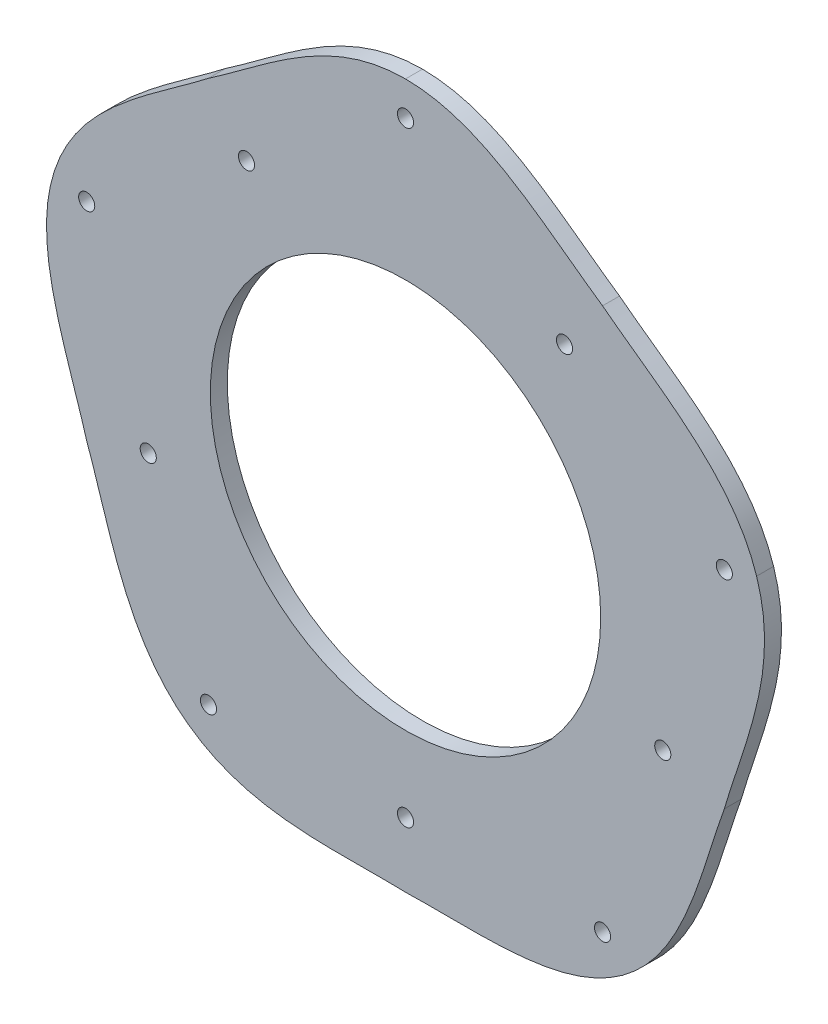
from build123d import *

# Parameters (mm, degrees)
SZKIC1_R                    = 1.9
SZKIC1_R_2                  = 46
DODANIE_WYCI_GNI_CIE1_DEPTH = 4


with BuildPart() as part:
    # Szkic1 → Dodanie-wyciągnięcie1 (new body)
    with BuildSketch(Plane.XY):
        with BuildLine():
            add(Edge.make_bspline(
                [(0, 87), (18.224844976, 86.998612649), (32.288902875, 73.536902698), (46.435034931, 63.912342556)],
                knots=[0, 0, 0, 0, 1, 1, 1, 1], degree=3))
            add(Edge.make_bspline(
                [(0, 87), (-18.224844976, 86.998612649), (-32.288902875, 73.536902698), (-46.435034931, 63.912342556)],
                knots=[0, 0, 0, 0, 1, 1, 1, 1], degree=3))
            add(Edge.make_bspline(
                [(-82.741916918, 26.884478511), (-77.108810651, 44.216907368), (-59.959930782, 53.43272413), (-46.435034931, 63.912342556)],
                knots=[0, 0, 0, 0, 1, 1, 1, 1], degree=3))
            add(Edge.make_bspline(
                [(-82.741916918, 26.884478511), (-88.372384286, 9.551192223), (-79.915570217, -7.984418835), (-75.133464787, -24.412342556)],
                knots=[0, 0, 0, 0, 1, 1, 1, 1], degree=3))
            add(Edge.make_bspline(
                [(-51.137316949, -70.384478511), (-65.88071079, -59.671061018), (-69.346178061, -40.513663074), (-75.133464787, -24.412342556)],
                knots=[0, 0, 0, 0, 1, 1, 1, 1], degree=3))
            add(Edge.make_bspline(
                [(-51.137316949, -70.384478511), (-36.39229218, -81.095651222), (-17.10163575, -78.471544919), (0, -79)],
                knots=[0, 0, 0, 0, 1, 1, 1, 1], degree=3))
            add(Edge.make_bspline(
                [(51.137316949, -70.384478511), (36.39229218, -81.095651222), (17.10163575, -78.471544919), (0, -79)],
                knots=[0, 0, 0, 0, 1, 1, 1, 1], degree=3))
            add(Edge.make_bspline(
                [(51.137316949, -70.384478511), (65.88071079, -59.671061018), (69.346178061, -40.513663074), (75.133464787, -24.412342556)],
                knots=[0, 0, 0, 0, 1, 1, 1, 1], degree=3))
            add(Edge.make_bspline(
                [(82.741916918, 26.884478511), (88.372384286, 9.551192223), (79.915570217, -7.984418835), (75.133464787, -24.412342556)],
                knots=[0, 0, 0, 0, 1, 1, 1, 1], degree=3))
            add(Edge.make_bspline(
                [(82.741916918, 26.884478511), (77.108810651, 44.216907368), (59.959930782, 53.43272413), (46.435034931, 63.912342556)],
                knots=[0, 0, 0, 0, 1, 1, 1, 1], degree=3))
        make_face()
        with Locations((-46.435034931, -63.912342556)):
            Circle(SZKIC1_R, mode=Mode.SUBTRACT)
        with Locations((75.133464787, 24.412342556)):
            Circle(SZKIC1_R, mode=Mode.SUBTRACT)
        with Locations((46.435034931, -63.912342556)):
            Circle(SZKIC1_R, mode=Mode.SUBTRACT)
        with Locations((-75.133464787, 24.412342556)):
            Circle(SZKIC1_R, mode=Mode.SUBTRACT)
        with Locations((0, 79)):
            Circle(SZKIC1_R, mode=Mode.SUBTRACT)
        with Locations((37.471309834, 51.574833391)):
            Circle(SZKIC1_R, mode=Mode.SUBTRACT)
        with Locations((-60.629852914, -19.699833391)):
            Circle(SZKIC1_R, mode=Mode.SUBTRACT)
        with Locations((0, -63.75)):
            Circle(SZKIC1_R, mode=Mode.SUBTRACT)
        with Locations((60.629852914, -19.699833391)):
            Circle(SZKIC1_R, mode=Mode.SUBTRACT)
        with Locations((-37.471309834, 51.574833391)):
            Circle(SZKIC1_R, mode=Mode.SUBTRACT)
        Circle(SZKIC1_R_2, mode=Mode.SUBTRACT)
    extrude(amount=DODANIE_WYCI_GNI_CIE1_DEPTH)


solid = part.part
